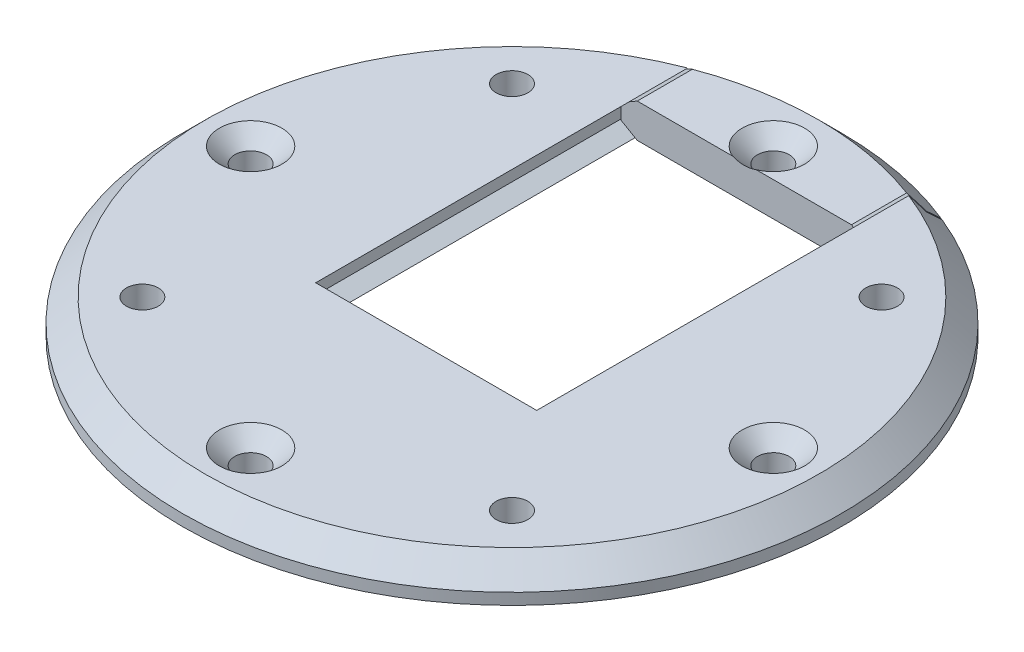
from build123d import *

# Parameters (mm, degrees)
SKETCH1_R                                      = 29
BOSS_EXTRUDE1_DEPTH                            = 1.5
CUT_EXTRUDE1_DEPTH                             = 42.12177039
BOSS_EXTRUDE2_REACH                            = 46.997
BOSS_EXTRUDE2_END_RADIUS                       = 29
BOSS_EXTRUDE3_REACH                            = 59.346
BOSS_EXTRUDE3_END_RADIUS                       = 29
CHAMFER1_SIZE                                  = 2
CHAMFER2_SIZE                                  = 2
SKETCH5_R                                      = 1.4
CUT_EXTRUDE2_DEPTH                             = 42.12177039
CSK_FOR_M2_5_FLAT_HEAD_MACHINE_SCREW1_AT_COUNT = 2
CSK_FOR_M2_5_FLAT_HEAD_MACHINE_SCREW1_AT_PITCH = 32.526911935
CSK_FOR_M2_5_FLAT_HEAD_MACHINE_SCREW_2_COUNT   = 2
CSK_FOR_M2_5_FLAT_HEAD_MACHINE_SCREW_2_PITCH   = 46
CSK_FOR_M2_5_FLAT_HEAD_MACHINE_SCREW_3_COUNT   = 2
CSK_FOR_M2_5_FLAT_HEAD_MACHINE_SCREW_3_PITCH   = 32.526911935


with BuildPart() as part:
    # Sketch1 → Boss-Extrude1 (new, symmetric)
    with BuildSketch(Plane(origin=(0, 0, 0), x_dir=(1, 0, 0), z_dir=(0, 1, 0))):
        with Locations(Location((0, 0, 0), (0, 0, 270))):
            Circle(SKETCH1_R)
    extrude(amount=BOSS_EXTRUDE1_DEPTH, both=True)

    # Sketch2 → Cut-Extrude1 (cut, through all)
    with BuildSketch(Plane(origin=(0, 1.5, 0), x_dir=(1, 0, 0), z_dir=(0, 1, 0))):
        Polygon((-11.025, 7.55), (-11.025, 29), (11.025, 29), (11.025, 7.55), (11.025, -7.55), (-11.025, -7.55), align=None)
    extrude(amount=-CUT_EXTRUDE1_DEPTH, mode=Mode.SUBTRACT)

    # Boss-Extrude2: up to this cylinder (the profile starts inside it)
    boss_extrude2_end = Plane(origin=(0, -0.7325095, 0), z_dir=(0, -1, 0)) * Cylinder(BOSS_EXTRUDE2_END_RADIUS, 154.459019, mode=Mode.PRIVATE)
    # Sketch3 → Boss-Extrude2 (add, up to the surface)
    with BuildSketch(Plane(origin=(0, 0, 7.55), x_dir=(-1, 0, 0), z_dir=(0, 0, -1)), mode=Mode.PRIVATE) as boss_extrude2_sk1:
        Polygon((-11.525, -1.5), (-9.725961894, -1.5), (-11.025, -0.75), (-11.025, 0.75), (-9.725961894, 1.5), (-11.525, 1.5), align=None)
    boss_extrude2_tool1 = extrude(boss_extrude2_sk1.sketch, amount=BOSS_EXTRUDE2_REACH, mode=Mode.PRIVATE) & boss_extrude2_end
    add(boss_extrude2_tool1.solids().sort_by_distance((10.625481, -1.465019, 7.55))[0])
    # Sketch3 → Boss-Extrude2 (add, up to the surface)
    with BuildSketch(Plane(origin=(0, 0, 7.55), x_dir=(-1, 0, 0), z_dir=(0, 0, -1)), mode=Mode.PRIVATE) as boss_extrude2_sk2:
        Polygon((11.525, 1.5), (11.525, -1.5), (9.725961894, -1.5), (11.025, -0.75), (11.025, 0.75), (9.725961894, 1.5), align=None)
    boss_extrude2_tool2 = extrude(boss_extrude2_sk2.sketch, amount=BOSS_EXTRUDE2_REACH, mode=Mode.PRIVATE) & boss_extrude2_end
    add(boss_extrude2_tool2.solids().sort_by_distance((-11.490019, 0, 7.55))[0])

    # Chamfer1
    chamfer1_edges = [part.edges().sort_by_distance(p)[0] for p in [
        (0, 1.5, 29),
    ]]
    chamfer(chamfer1_edges, length=CHAMFER1_SIZE)


with BuildPart() as body_2:
    # Boss-Extrude3: up to this cylinder (the profile starts inside it)
    boss_extrude3_end = Plane(origin=(0, 0, 0), z_dir=(0, -1, 0)) * Cylinder(BOSS_EXTRUDE3_END_RADIUS, 177.692, mode=Mode.PRIVATE)
    # Sketch6 → Boss-Extrude3 (new, up to the surface)
    with BuildSketch(Plane(origin=(0, 0, -20.45), x_dir=(-1, 0, 0), z_dir=(0, 0, -1)), mode=Mode.PRIVATE) as boss_extrude3_sk1:
        Polygon((9.425961894, -1.5), (-9.425961894, -1.5), (-10.875, -0.66339746), (-10.875, 0.66339746), (-9.425961894, 1.5), (9.425961894, 1.5), (10.875, 0.66339746), (10.875, -0.66339746), align=None)
    boss_extrude3_tool1 = extrude(boss_extrude3_sk1.sketch, amount=BOSS_EXTRUDE3_REACH, mode=Mode.PRIVATE) & boss_extrude3_end
    add(boss_extrude3_tool1.solids().sort_by_distance((0, 0, -20.45))[0])

    # Chamfer2
    # the kernel refuses this chamfer: 2 mm, written as the material it takes off along each edge
    with BuildSketch(Plane(origin=(0, 1.5, 0), x_dir=(-0.48679499684040417, 0, -0.8735162454420358), z_dir=(-0.8735162454420358, 0, 0.48679499684040417))) as chamfer2_piece_1:
        Polygon((29 - CHAMFER2_SIZE, 0), (29, CHAMFER2_SIZE), (29, 0), align=None)
    revolve(axis=Axis((0, 1.5, 0), (0, -1, 0)), revolution_arc=58.260285593, mode=Mode.SUBTRACT)


with BuildPart() as cut_extrude2_tool:
    # Sketch5 → Cut-Extrude2 (new, through all)
    with BuildSketch(Plane(origin=(0, 1.5, 0), x_dir=(1, 0, 0), z_dir=(0, 1, 0))):
        with Locations(Location((0, 23, 0), (0, 0, 270))):
            Circle(SKETCH5_R)
        with Locations(Location((16.263455967, 16.263455967, 0), (0, 0, 270))):
            Circle(SKETCH5_R)
        with Locations(Location((23, 0, 0), (0, 0, 270))):
            Circle(SKETCH5_R)
        with Locations(Location((16.263455967, -16.263455967, 0), (0, 0, 270))):
            Circle(SKETCH5_R)
        with Locations(Location((0, -23, 0), (0, 0, 270))):
            Circle(SKETCH5_R)
        with Locations(Location((-16.263455967, -16.263455967, 0), (0, 0, 270))):
            Circle(SKETCH5_R)
        with Locations(Location((-23, 0, 0), (0, 0, 270))):
            Circle(SKETCH5_R)
        with Locations(Location((-16.263455967, 16.263455967, 0), (0, 0, 270))):
            Circle(SKETCH5_R)
    extrude(amount=-CUT_EXTRUDE2_DEPTH)


with BuildPart() as part_1:
    add(part.part)

    # Cut-Extrude2: cut by cut_extrude2_tool
    add(cut_extrude2_tool.part, mode=Mode.SUBTRACT)


with BuildPart() as body_2_1:
    add(body_2.part)

    # Cut-Extrude2: cut by cut_extrude2_tool
    add(cut_extrude2_tool.part, mode=Mode.SUBTRACT)

    # Sketch8 → CSK for M2.5 Flat Head Machine Screw1 (revolve, cut)
    with BuildSketch(Plane(origin=(0, 1.5, -23), x_dir=(0, 0, 1), z_dir=(1, 0, 0))):
        Polygon((0, 0), (0, 3), (1.35, 3), (1.35, 1.4), (2.75, 0), align=None)
    csk_for_m2_5_flat_head_machine_screw1 = revolve(axis=Axis((0, 7.85, -23), (0, -1, 0)), mode=Mode.SUBTRACT)


with BuildPart() as part_2:
    add(part_1.part)

    # CSK for M2.5 Flat Head Machine Screw1 at: CSK for M2.5 Flat Head Machine Screw1 ×2
    with Locations(*[Vector(0.707106781186556, 0, 0.7071067811865391) * (i * CSK_FOR_M2_5_FLAT_HEAD_MACHINE_SCREW1_AT_PITCH) for i in range(1, CSK_FOR_M2_5_FLAT_HEAD_MACHINE_SCREW1_AT_COUNT)]):
        add(csk_for_m2_5_flat_head_machine_screw1, mode=Mode.SUBTRACT)

    # CSK for M2.5 Flat Head Machine Screw 2: CSK for M2.5 Flat Head Machine Screw1 ×2
    with Locations(*[(0, 0, i * CSK_FOR_M2_5_FLAT_HEAD_MACHINE_SCREW_2_PITCH) for i in range(1, CSK_FOR_M2_5_FLAT_HEAD_MACHINE_SCREW_2_COUNT)]):
        add(csk_for_m2_5_flat_head_machine_screw1, mode=Mode.SUBTRACT)

    # CSK for M2.5 Flat Head Machine Screw 3: CSK for M2.5 Flat Head Machine Screw1 ×2
    with Locations(*[Vector(-0.7071067811865475, 0, 0.7071067811865476) * (i * CSK_FOR_M2_5_FLAT_HEAD_MACHINE_SCREW_3_PITCH) for i in range(1, CSK_FOR_M2_5_FLAT_HEAD_MACHINE_SCREW_3_COUNT)]):
        add(csk_for_m2_5_flat_head_machine_screw1, mode=Mode.SUBTRACT)


solid = Compound([body_2_1.part, part_2.part])
